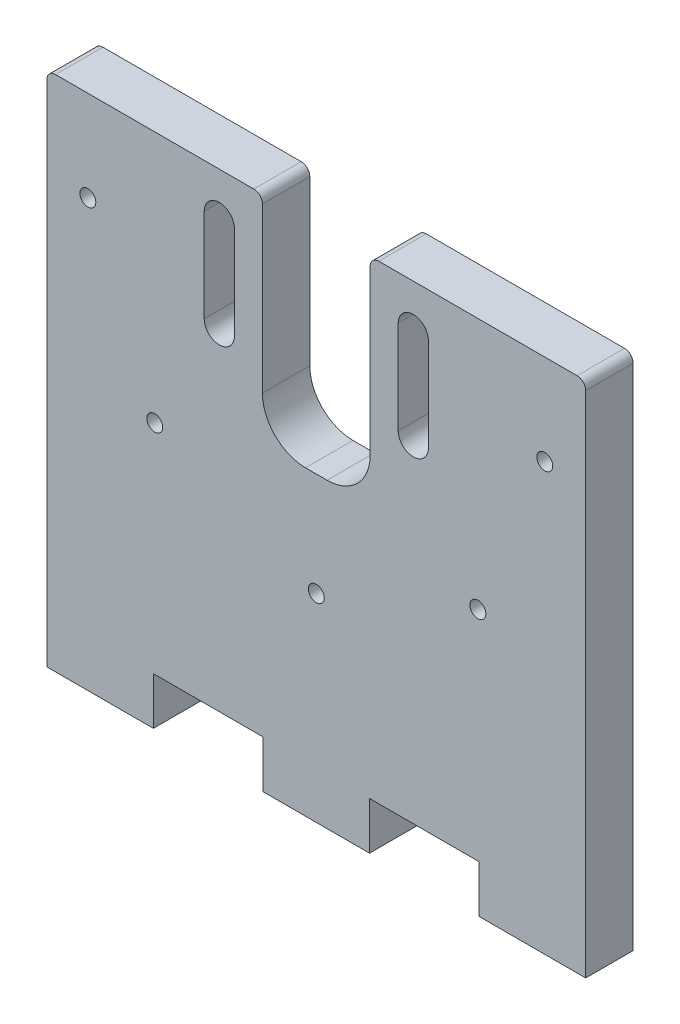
from build123d import *

# Parameters (mm, degrees)
SKETCH2_R           = 1.85
BOSS_EXTRUDE7_DEPTH = 11


with BuildPart() as part:
    # Sketch2 → Boss-Extrude7 (new body)
    with BuildSketch(Plane.XY):
        with BuildLine():
            Line((-0.187241808, 0), (-0.187241808, 118))
            ThreePointArc((-0.187241808, 118), (0.39854463, 119.414213562), (1.812758192, 120))
            Line((1.812758192, 120), (47.812758192, 120))
            ThreePointArc((47.812758192, 120), (49.226971755, 119.414213562), (49.812758192, 118))
            Line((49.812758192, 118), (49.812758192, 80))
            ThreePointArc((49.812758192, 80), (52.74169038, 72.928932188), (59.812758192, 70))
            Line((59.812758192, 70), (64.812758192, 70))
            ThreePointArc((64.812758192, 70), (71.883826004, 72.928932188), (74.812758192, 80))
            Line((74.812758192, 80), (74.812758192, 118))
            ThreePointArc((74.812758192, 118), (75.39854463, 119.414213562), (76.812758192, 120))
            Line((76.812758192, 120), (122.812758192, 120))
            ThreePointArc((122.812758192, 120), (124.226971755, 119.414213562), (124.812758192, 118))
            Line((124.812758192, 118), (124.812758192, 0))
            Line((124.812758192, 0), (100.112758192, 0))
            Line((100.112758192, 0), (100.112758192, 11))
            Line((100.112758192, 11), (74.662758192, 11))
            Line((74.662758192, 11), (74.662758192, 0))
            Line((74.662758192, 0), (49.962758192, 0))
            Line((49.962758192, 0), (49.962758192, 11))
            Line((49.962758192, 11), (24.512758192, 11))
            Line((24.512758192, 11), (24.512758192, 0))
            Line((24.512758192, 0), (-0.187241808, 0))
        make_face()
        with Locations((62.312758192, 46)):
            Circle(SKETCH2_R, mode=Mode.SUBTRACT)
        with Locations((24.836098789, 61.523340597)):
            Circle(SKETCH2_R, mode=Mode.SUBTRACT)
        with Locations((9.312758192, 99)):
            Circle(SKETCH2_R, mode=Mode.SUBTRACT)
        with Locations((115.312758192, 99)):
            Circle(SKETCH2_R, mode=Mode.SUBTRACT)
        with Locations((99.789417595, 61.523340597)):
            Circle(SKETCH2_R, mode=Mode.SUBTRACT)
        with BuildLine():
            Line((36.312758192, 88.190430343), (36.312758192, 109.809569657))
            ThreePointArc((36.312758192, 109.809569657), (39.812758192, 113.309569657), (43.312758192, 109.809569657))
            Line((43.312758192, 109.809569657), (43.312758192, 88.190430343))
            ThreePointArc((43.312758192, 88.190430343), (39.812758192, 84.690430343), (36.312758192, 88.190430343))
        make_face(mode=Mode.SUBTRACT)
        with BuildLine():
            Line((88.312758192, 88.190430343), (88.312758192, 109.809569657))
            ThreePointArc((88.312758192, 109.809569657), (84.812758192, 113.309569657), (81.312758192, 109.809569657))
            Line((81.312758192, 109.809569657), (81.312758192, 88.190430343))
            ThreePointArc((81.312758192, 88.190430343), (84.812758192, 84.690430343), (88.312758192, 88.190430343))
        make_face(mode=Mode.SUBTRACT)
    extrude(amount=BOSS_EXTRUDE7_DEPTH)


solid = part.part
